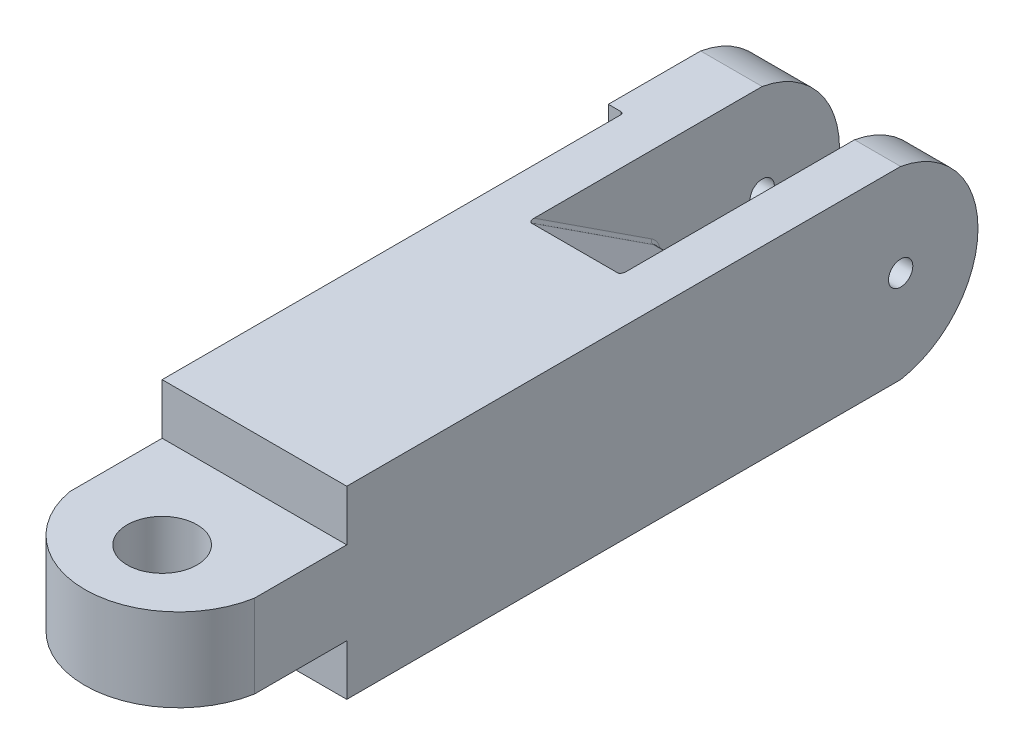
from build123d import *

# Parameters (mm, degrees)
SKETCH2_W               = 60
SKETCH2_H               = 60
BOSS_EXTRUDE1_DEPTH     = 150
SKETCH3_W               = 15
SKETCH3_H               = 60
BOSS_EXTRUDE2_DEPTH     = 30
BOSS_EXTRUDE3_DEPTH     = 15
BOSS_EXTRUDE4_START     = -15
BOSS_EXTRUDE4_DEPTH     = 15
SKETCH6_W               = 60
SKETCH6_H               = 27
BOSS_EXTRUDE5_DEPTH     = 30
BOSS_EXTRUDE6_DEPTH     = 27
CUT_EXTRUDE2_DEPTH      = 5
CUT_EXTRUDE2_DEPTH_BACK = 70
CUT_EXTRUDE2_START      = -10
SKETCH8_W               = 50.5
SKETCH8_H               = 50.5
SKETCH9_R               = 11.35
CUT_EXTRUDE3_DEPTH      = 130
SKETCH11_R              = 3.95
CUT_EXTRUDE4_DEPTH      = 213.148433405
SKETCH12_R              = 3.95
CUT_EXTRUDE5_DEPTH      = 213.148433405
BOSS_EXTRUDE7_DEPTH     = 5
SKETCH14_R              = 4.15
CUT_EXTRUDE6_DEPTH      = 10
FILLET2_R               = 1
CUT_EXTRUDE8_DEPTH      = 30
FILLET7_R               = 5
FILLET8_R               = 1
FILLET9_R               = 1


with BuildPart() as part:
    # Sketch2 → Boss-Extrude1 (new body)
    with BuildSketch(Plane.XY):
        Rectangle(SKETCH2_W, SKETCH2_H)
    extrude(amount=BOSS_EXTRUDE1_DEPTH)

    # Sketch3 → Boss-Extrude2 (add)
    with BuildSketch(Plane(origin=(0, 0, 0), x_dir=(-1, 0, 0), z_dir=(0, 0, -1))):
        with Locations((22.5, 0)):
            Rectangle(SKETCH3_W, SKETCH3_H)
        with Locations((-22.5, 0)):
            Rectangle(SKETCH3_W, SKETCH3_H)
    extrude(amount=BOSS_EXTRUDE2_DEPTH)

    # Sketch4 → Boss-Extrude3 (add)
    with BuildSketch(Plane(origin=(30, 0, 0), x_dir=(0, 0, -1), z_dir=(1, 0, 0))):
        with BuildLine():
            Line((30, 30), (30, -30))
            ThreePointArc((30, -30), (55.138874415, 0), (30, 30))
        make_face()
    extrude(amount=-BOSS_EXTRUDE3_DEPTH)

    # Sketch5 → Boss-Extrude4 (add)
    with BuildSketch(Plane.ZY.offset(30).offset(BOSS_EXTRUDE4_START)):
        with BuildLine():
            Line((-30, -30), (-30, 30))
            ThreePointArc((-30, 30), (-55.138874415, 0), (-30, -30))
        make_face()
    extrude(amount=BOSS_EXTRUDE4_DEPTH)

    # Sketch6 → Boss-Extrude5 (add)
    with BuildSketch(Plane.XY.offset(150)):
        Rectangle(SKETCH6_W, SKETCH6_H)
    extrude(amount=BOSS_EXTRUDE5_DEPTH)

    # Sketch7 → Boss-Extrude6 (add)
    with BuildSketch(Plane(origin=(0, 13.5, 0), x_dir=(1, 0, 0), z_dir=(0, 1, 0))):
        with BuildLine():
            Line((30, -180), (-30, -180))
            ThreePointArc((-30, -180), (0, -205.138874415), (30, -180))
        make_face()
    extrude(amount=-BOSS_EXTRUDE6_DEPTH)

    # Sketch8 → Cut-Extrude2 (cut, two sides: drawn at the far end of the back side and taken through both)
    with BuildSketch(Plane.XY.offset(150).offset(CUT_EXTRUDE2_START - CUT_EXTRUDE2_DEPTH_BACK)):
        Rectangle(SKETCH8_W, SKETCH8_H)
    extrude(amount=CUT_EXTRUDE2_DEPTH + CUT_EXTRUDE2_DEPTH_BACK, mode=Mode.SUBTRACT)

    # Sketch9 → Cut-Extrude3 (cut)
    with BuildSketch(Plane(origin=(0, -13.5, 0), x_dir=(-1, 0, 0), z_dir=(0, -1, 0))):
        with Locations((0, -180)):
            Circle(SKETCH9_R)
    extrude(amount=-CUT_EXTRUDE3_DEPTH, mode=Mode.SUBTRACT)

    # Sketch11 → Cut-Extrude4 (cut, through all)
    with BuildSketch(Plane.ZY.offset(-15)):
        with Locations((-30, 0)):
            Circle(SKETCH11_R)
    extrude(amount=-CUT_EXTRUDE4_DEPTH, mode=Mode.SUBTRACT)

    # Sketch12 → Cut-Extrude5 (cut, through all)
    with BuildSketch(Plane(origin=(-15, 0, 0), x_dir=(0, 0, -1), z_dir=(1, 0, 0))):
        with Locations((30, 0)):
            Circle(SKETCH12_R)
    extrude(amount=-CUT_EXTRUDE5_DEPTH, mode=Mode.SUBTRACT)

    # Sketch13 → Boss-Extrude7 (add)
    with BuildSketch(Plane.ZY.offset(30)):
        with BuildLine():
            Line((-30, 30), (0, 30))
            Line((0, 30), (0, -30))
            Line((0, -30), (-30, -30))
            ThreePointArc((-30, -30), (-55.138874415, 0), (-30, 30))
        make_face()
    extrude(amount=BOSS_EXTRUDE7_DEPTH)

    # Sketch14 → Cut-Extrude6 (cut)
    with BuildSketch(Plane.ZY.offset(35)):
        with Locations((-30, 0)):
            Circle(SKETCH14_R)
    extrude(amount=-CUT_EXTRUDE6_DEPTH, mode=Mode.SUBTRACT)

    # Fillet2
    fillet2_edges = [part.edges().sort_by_distance(p)[0] for p in [
        (-30, 0, 0),
    ]]
    fillet(fillet2_edges, radius=FILLET2_R)

    # Sketch19 → Cut-Extrude8 (cut)
    with BuildSketch(Plane.ZY.offset(-15)):
        Polygon((0, 0), (0, -30), (45.937030861, -30), align=None)
        Polygon((0, 30), (0, 0), (45.937030861, 30), align=None)
    extrude(amount=CUT_EXTRUDE8_DEPTH, mode=Mode.SUBTRACT)

    # Fillet7
    fillet7_edges = [part.edges().sort_by_distance(p)[0] for p in [
        (0, 0, 0),
    ]]
    fillet(fillet7_edges, radius=FILLET7_R)

    # Fillet8
    fillet8_edges = [part.edges().sort_by_distance(p)[0] for p in [
        (15, -17.09316987, 26.173649061),
        (15, 0, 4.144231339),
        (15, 17.09316987, 26.173649061),
    ]]
    fillet(fillet8_edges, radius=FILLET8_R)

    # Fillet9
    fillet9_edges = [part.edges().sort_by_distance(p)[0] for p in [
        (-15, -17.09316987, 26.173649061),
        (-15, 0, 4.144231339),
        (-15, 17.09316987, 26.173649061),
    ]]
    fillet(fillet9_edges, radius=FILLET9_R)


solid = part.part
